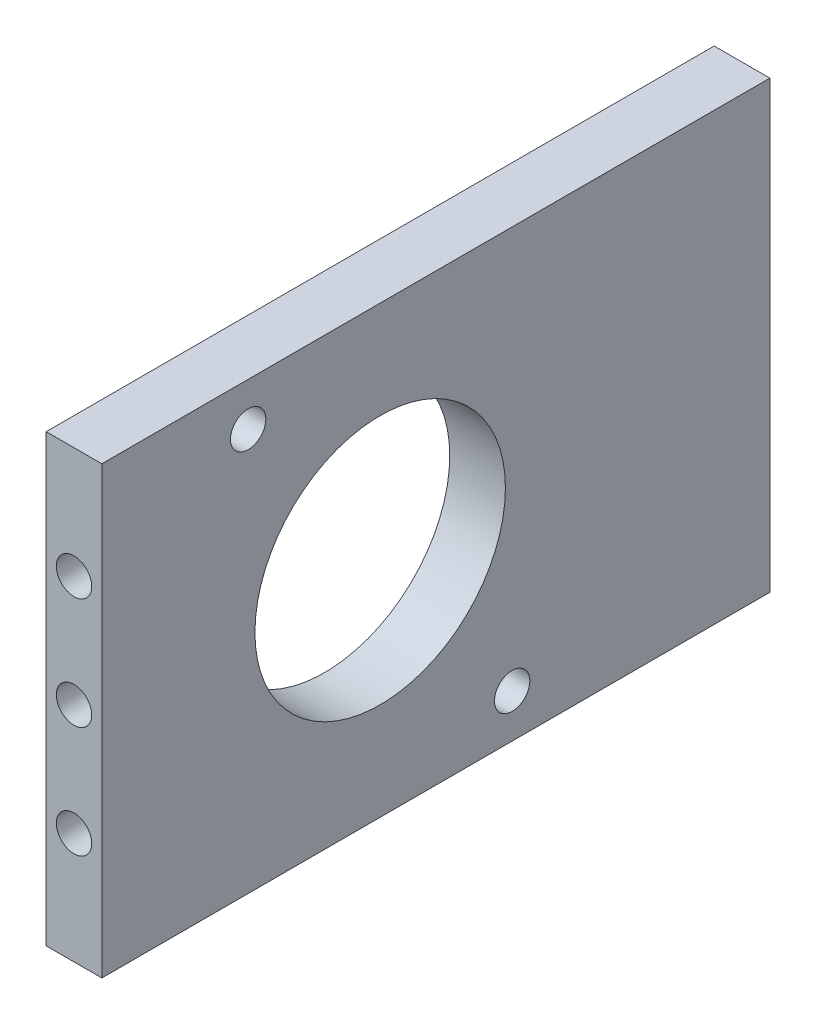
from build123d import *

# Parameters (mm, degrees)
SKETCH2_W                  = 76.2
SKETCH2_H                  = 50.8
BOSS_EXTRUDE2_DEPTH        = 6.35
F_10_32_TAPPED_HOLE1_D     = 4.0386
F_10_32_TAPPED_HOLE1_DEPTH = 12.02944
F_10_32_TAPPED_HOLE1_TIP   = 1.213317848
SKETCH6_R                  = 14.2875
CUT_EXTRUDE1_DEPTH         = 47.228697797
F_10_32_TAPPED_HOLE2_D     = 4.0386
F_10_32_TAPPED_HOLE2_DEPTH = 12.02944
F_10_32_TAPPED_HOLE2_TIP   = 1.213317848


with BuildPart() as part:
    # Sketch2 → Boss-Extrude2 (new body)
    with BuildSketch(Plane(origin=(0, 0, 0), x_dir=(0, 0, -1), z_dir=(1, 0, 0))):
        Rectangle(SKETCH2_W, SKETCH2_H)
    extrude(amount=BOSS_EXTRUDE2_DEPTH)

    # #10-32 Tapped Hole1
    with Locations(Plane.XY.offset(38.1)):
        with Locations((3.175, -12.7), (3.175, 0), (3.175, 12.7)):
            Hole(F_10_32_TAPPED_HOLE1_D / 2, depth=F_10_32_TAPPED_HOLE1_DEPTH)
            with Locations((0, 0, -(F_10_32_TAPPED_HOLE1_DEPTH + F_10_32_TAPPED_HOLE1_TIP / 2))):  # 118° drill point
                Cone(0, F_10_32_TAPPED_HOLE1_D / 2, F_10_32_TAPPED_HOLE1_TIP, mode=Mode.SUBTRACT)

    # Sketch6 → Cut-Extrude1 (cut, through all)
    with BuildSketch(Plane(origin=(6.35, 0, 0), x_dir=(0, 0, -1), z_dir=(1, 0, 0))):
        with Locations((-6.35, 0)):
            Circle(SKETCH6_R)
    extrude(amount=-CUT_EXTRUDE1_DEPTH, mode=Mode.SUBTRACT)

    # #10-32 Tapped Hole2
    with Locations(Plane.ZY):
        with Locations((-8.704100278, -20.440822776), (21.413163559, 20.468716687)):
            Hole(F_10_32_TAPPED_HOLE2_D / 2, depth=F_10_32_TAPPED_HOLE2_DEPTH)
            with Locations((0, 0, -(F_10_32_TAPPED_HOLE2_DEPTH + F_10_32_TAPPED_HOLE2_TIP / 2))):  # 118° drill point
                Cone(0, F_10_32_TAPPED_HOLE2_D / 2, F_10_32_TAPPED_HOLE2_TIP, mode=Mode.SUBTRACT)


solid = part.part
